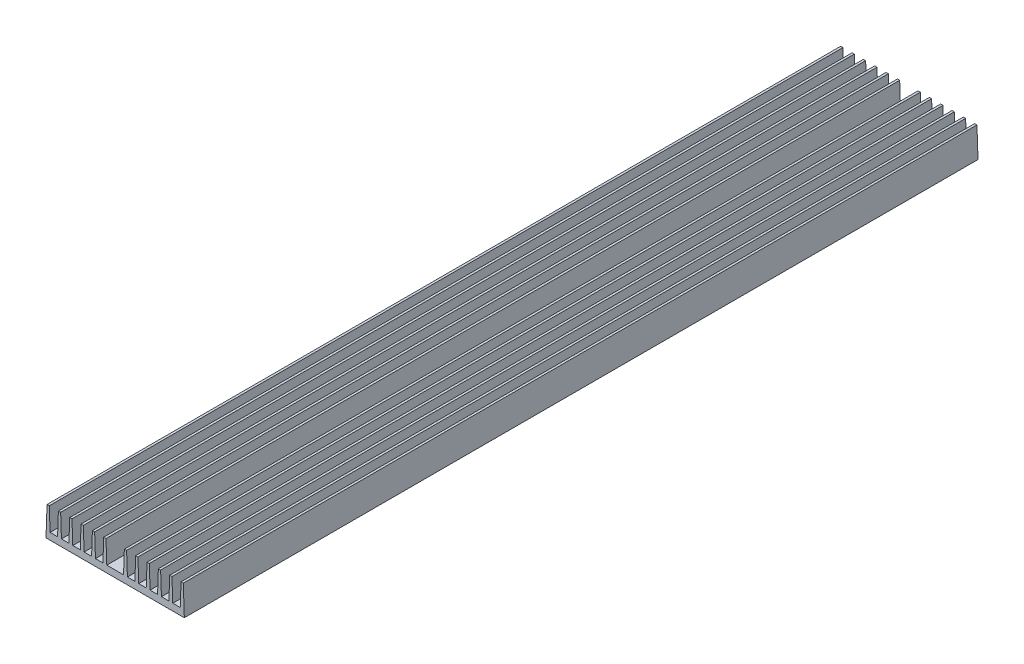
from build123d import *

# Parameters (mm, degrees)
BOSS_EXTRUDE1_DEPTH      = 350
BOSS_EXTRUDE1_DEPTH_BACK = 350


with BuildPart() as part:
    # Sketch1 → Boss-Extrude1 (new, two sides: drawn at the far end of the back side and taken through both)
    with BuildSketch(Plane.XY.offset(-BOSS_EXTRUDE1_DEPTH_BACK)):
        Polygon((61, 0), (-61, 0), (-60.092059993, 26), (-58.092059993, 26), (-57.393644603, 6), (-50.790475383, 6), (-50.092059993, 26), (-48.092059993, 26), (-47.393644603, 6), (-40.790475383, 6), (-40.092059993, 26), (-38.092059993, 26), (-37.393644603, 6), (-30.790475383, 6), (-30.092059993, 26), (-28.092059993, 26), (-27.393644603, 6), (-20.790475383, 6), (-20.092059993, 26), (-18.092059993, 26), (-17.393644603, 6), (-10.790475383, 6), (-10.092059993, 26), (-8.092059993, 26), (-7.393644603, 6), (7.393644603, 6), (8.092059993, 26), (10.092059993, 26), (10.790475383, 6), (17.393644603, 6), (18.092059993, 26), (20.092059993, 26), (20.790475383, 6), (27.393644603, 6), (28.092059993, 26), (30.092059993, 26), (30.790475383, 6), (37.393644603, 6), (38.092059993, 26), (40.092059993, 26), (40.790475383, 6), (47.393644603, 6), (48.092059993, 26), (50.092059993, 26), (50.790475383, 6), (57.393644603, 6), (58.092059993, 26), (60.092059993, 26), align=None)
    extrude(amount=BOSS_EXTRUDE1_DEPTH + BOSS_EXTRUDE1_DEPTH_BACK)


solid = part.part
